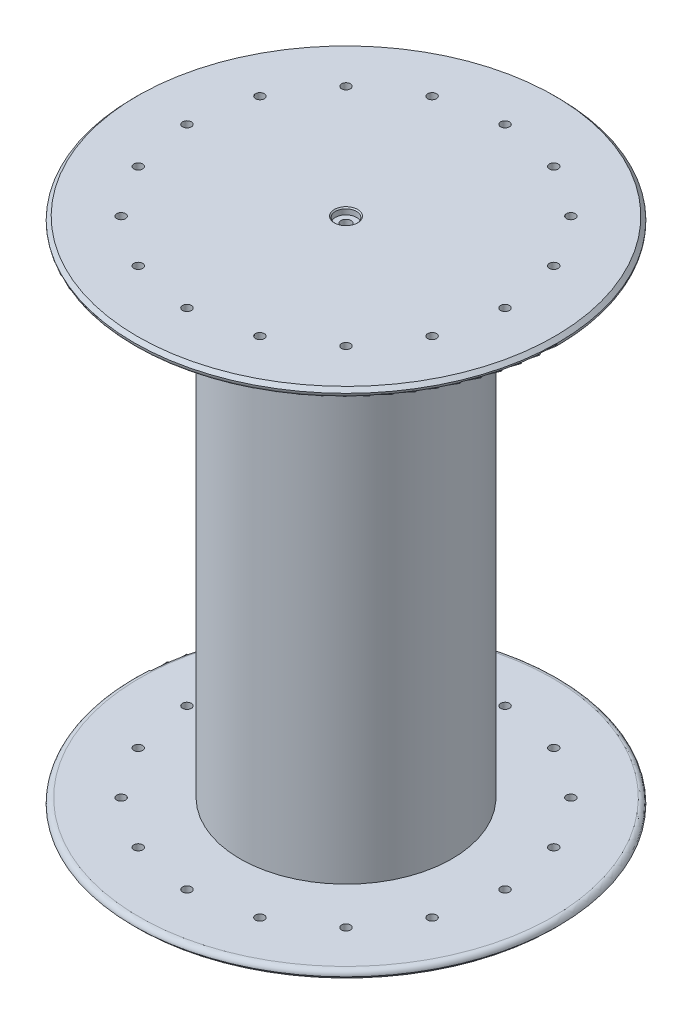
from build123d import *

# Parameters (mm, degrees)
SKETCH1_R                = 60
BOSS_EXTRUDE1_DEPTH      = 140
SKETCH3_R                = 120
BOSS_EXTRUDE2_DEPTH      = 5
CHAMFER1_SIZE            = 2
FILLET1_R                = 3
CHAMFER1_OF_MIRROR8_SIZE = 2
FILLET1_OF_MIRROR8_R     = 3
SKETCH4_R                = 2.5
CUT_EXTRUDE1_DEPTH       = 337.005952328
CIRPATTERN1_COUNT        = 16


with BuildPart() as part:
    # Sketch1 → Boss-Extrude1 (new, symmetric)
    with BuildSketch(Plane(origin=(0, 0, 0), x_dir=(1, 0, 0), z_dir=(0, 1, 0))):
        with Locations(Location((0, 0, 0), (0, 0, 270))):
            Circle(SKETCH1_R)
    extrude(amount=BOSS_EXTRUDE1_DEPTH, both=True)

    # Sketch3 → Boss-Extrude2 (add)
    with BuildSketch(Plane(origin=(0, 140, 0), x_dir=(1, 0, 0), z_dir=(0, 1, 0))):
        with Locations(Location((0, 0, 0), (0, 0, 270))):
            Circle(SKETCH3_R)
    boss_extrude2 = extrude(amount=BOSS_EXTRUDE2_DEPTH)

    # Chamfer1
    chamfer1_edges = [part.edges().sort_by_distance(p)[0] for p in [
        (0, 145, -120),
    ]]
    chamfer(chamfer1_edges, length=CHAMFER1_SIZE)

    # Fillet1
    fillet1_edges = [part.edges().sort_by_distance(p)[0] for p in [
        (0, 140, -120),
    ]]
    fillet(fillet1_edges, radius=FILLET1_R - 0.0001)  # a hair under: the kernel refuses the full size

    # Sketch8 → CBORE for #12 Binding Head Machine Screw2 (revolve, cut)
    with BuildSketch(Plane(origin=(0, 145, 0), x_dir=(0, 0, 1), z_dir=(1, 0, 0))):
        Polygon((0, 0), (0, 290), (2.8956, 290), (2.8956, 3.5814), (5.95376, 3.5814), (5.95376, 0.635), (6.58876, 0), align=None)
    cbore_for_12_binding_head_machine_screw = revolve(axis=Axis((0, 151.35, 0), (0, -1, 0)), mode=Mode.SUBTRACT)

    # Mirror8: Boss-Extrude2, CBORE for #12 Binding Head Machine Screw2 across plane
    add(boss_extrude2.mirror(Plane.ZX))
    add(cbore_for_12_binding_head_machine_screw.mirror(Plane.ZX), mode=Mode.SUBTRACT)

    # Chamfer1 of Mirror8
    chamfer1_of_mirror8_edges = [part.edges().sort_by_distance(p)[0] for p in [
        (0, -145, -120),
    ]]
    chamfer(chamfer1_of_mirror8_edges, length=CHAMFER1_OF_MIRROR8_SIZE)

    # Fillet1 of Mirror8
    fillet1_of_mirror8_edges = [part.edges().sort_by_distance(p)[0] for p in [
        (0, -140, -120),
    ]]
    fillet(fillet1_of_mirror8_edges, radius=FILLET1_OF_MIRROR8_R - 0.0001)  # a hair under: the kernel refuses the full size

    # Sketch4 → Cut-Extrude1 (cut, symmetric)
    with BuildSketch(Plane(origin=(0, 145, 0), x_dir=(1, 0, 0), z_dir=(0, 1, 0))):
        with Locations(Location((0, 90, 0), (0, 0, 270))):
            Circle(SKETCH4_R)
    cut_extrude1 = extrude(amount=CUT_EXTRUDE1_DEPTH, both=True, mode=Mode.SUBTRACT)

    # CirPattern1: Cut-Extrude1 ×16 about axis
    cirpattern1_axis = Axis((0, 0, 0), (0, 1, 0))
    for i in range(1, CIRPATTERN1_COUNT):
        add(cut_extrude1.rotate(cirpattern1_axis, i * 360 / CIRPATTERN1_COUNT), mode=Mode.SUBTRACT)


solid = part.part
